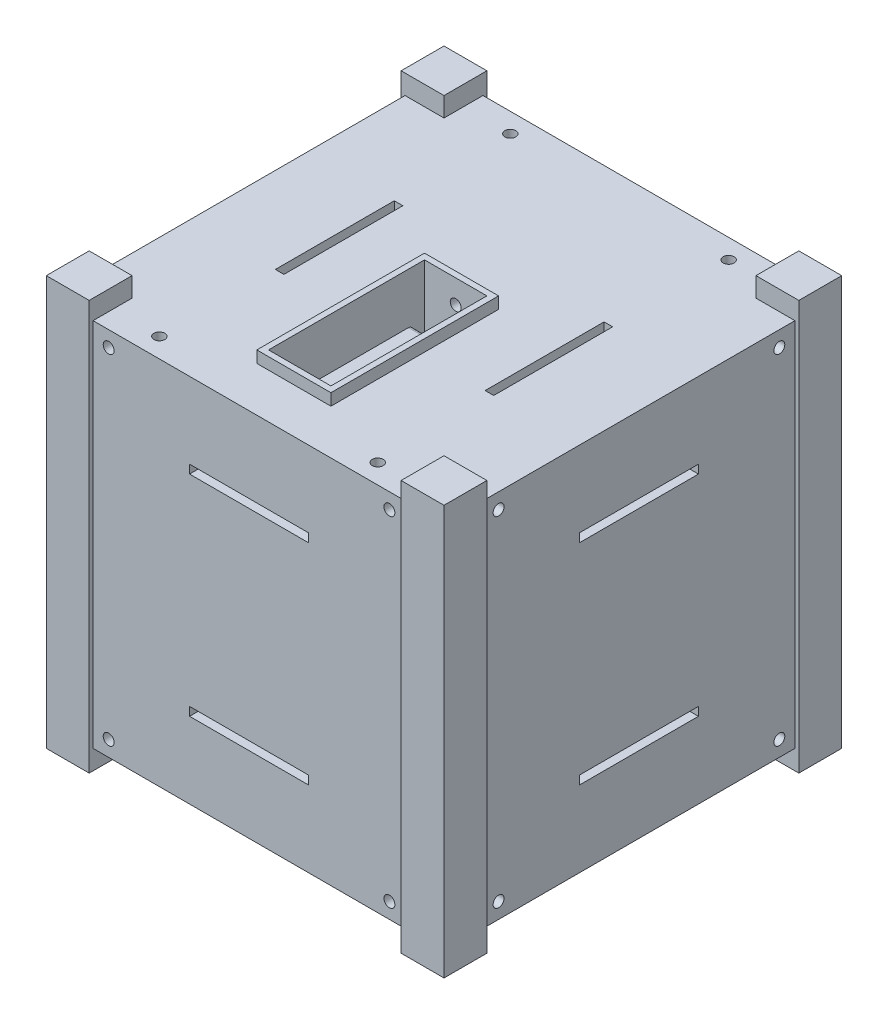
from build123d import *

# Parameters (mm, degrees)
SKETCH1_W           = 100
SKETCH1_H           = 100
BOSS_EXTRUDE1_DEPTH = 95
SKETCH2_W           = 10
SKETCH2_H           = 10
BOSS_EXTRUDE2_DEPTH = 105
SKETCH3_R           = 1.4
CUT_EXTRUDE1_DEPTH  = 10
SKETCH4_W           = 11
SKETCH4_H           = 11
BOSS_EXTRUDE3_DEPTH = 105
SKETCH5_R           = 1.4
CUT_EXTRUDE2_DEPTH  = 10
SKETCH6_R           = 1.4
CUT_EXTRUDE3_DEPTH  = 10
SKETCH7_W           = 19
SKETCH7_H           = 43
SKETCH7_W_2         = 16
SKETCH7_H_2         = 40
BOSS_EXTRUDE4_DEPTH = 3
SKETCH8_W           = 16
SKETCH8_H           = 40
CUT_EXTRUDE4_DEPTH  = 10
CHAMFER2_SIZE       = 13
SKETCH9_W           = 16
SKETCH9_H           = 3.1
CUT_EXTRUDE5_DEPTH  = 10
FILLET1_R           = 1
SKETCH10_R          = 1.4
CUT_EXTRUDE6_DEPTH  = 10
SKETCH11_R          = 5
BOSS_EXTRUDE5_DEPTH = 3
SKETCH12_W          = 30.5
SKETCH12_H          = 2.2
CUT_EXTRUDE7_DEPTH  = 3
SKETCH13_W          = 30.5
SKETCH13_H          = 2.2
CUT_EXTRUDE8_DEPTH  = 3
SKETCH14_W          = 2.2
SKETCH14_H          = 30.5
CUT_EXTRUDE9_DEPTH  = 3


with BuildPart() as part:
    # Sketch1 → Boss-Extrude1 (new body)
    with BuildSketch(Plane(origin=(0, 0, 0), x_dir=(1, 0, 0), z_dir=(0, 1, 0))):
        Rectangle(SKETCH1_W, SKETCH1_H)
    extrude(amount=BOSS_EXTRUDE1_DEPTH)

    # Sketch2 → Boss-Extrude2 (add)
    with BuildSketch(Plane(origin=(0, 100, 0), x_dir=(1, 0, 0), z_dir=(0, 1, 0))):
        with Locations((-45, 45)):
            Rectangle(SKETCH2_W, SKETCH2_H)
        with Locations((45, 45)):
            Rectangle(SKETCH2_W, SKETCH2_H)
        with Locations((45, -45)):
            Rectangle(SKETCH2_W, SKETCH2_H)
        with Locations((-45, -45)):
            Rectangle(SKETCH2_W, SKETCH2_H)
    extrude(amount=-BOSS_EXTRUDE2_DEPTH)

    # Sketch3 → Cut-Extrude1 (cut)
    with BuildSketch(Plane(origin=(0, 95, 0), x_dir=(1, 0, 0), z_dir=(0, 1, 0))):
        with Locations(Location((-28, -45, 0), (0, 0, 270))):
            Circle(SKETCH3_R)
        with Locations(Location((28, -45, 0), (0, 0, 90))):
            Circle(SKETCH3_R)
        with Locations(Location((28, 45, 0), (0, 0, 270))):
            Circle(SKETCH3_R)
        with Locations(Location((-28, 45, 0), (0, 0, 90))):
            Circle(SKETCH3_R)
    cut_extrude1 = extrude(amount=-CUT_EXTRUDE1_DEPTH, mode=Mode.SUBTRACT)

    # Sketch4 → Boss-Extrude3 (add)
    with BuildSketch(Plane(origin=(0, 100, 0), x_dir=(1, 0, 0), z_dir=(0, 1, 0))):
        with Locations((-45.5, 45.5)):
            Rectangle(SKETCH4_W, SKETCH4_H)
        with Locations((45.5, 45.5)):
            Rectangle(SKETCH4_W, SKETCH4_H)
        with Locations((45.5, -45.5)):
            Rectangle(SKETCH4_W, SKETCH4_H)
        with Locations((-45.5, -45.5)):
            Rectangle(SKETCH4_W, SKETCH4_H)
    extrude(amount=-BOSS_EXTRUDE3_DEPTH)

    # Sketch5 → Cut-Extrude2 (cut)
    with BuildSketch(Plane.XY.offset(50)):
        with Locations((-36, 91)):
            Circle(SKETCH5_R)
        with Locations(Location((36, 91, 0), (0, 0, 180))):
            Circle(SKETCH5_R)
        with Locations((36, 4)):
            Circle(SKETCH5_R)
        with Locations(Location((-36, 4, 0), (0, 0, 180))):
            Circle(SKETCH5_R)
    cut_extrude2 = extrude(amount=-CUT_EXTRUDE2_DEPTH, mode=Mode.SUBTRACT)

    # Mirror1: Cut-Extrude2 across plane
    add(cut_extrude2.mirror(Plane.XY), mode=Mode.SUBTRACT)

    # Sketch6 → Cut-Extrude3 (cut)
    with BuildSketch(Plane.ZY.offset(50)):
        with Locations((-36, 91)):
            Circle(SKETCH6_R)
        with Locations(Location((36, 91, 0), (0, 0, 180))):
            Circle(SKETCH6_R)
        with Locations((36, 4)):
            Circle(SKETCH6_R)
        with Locations(Location((-36, 4, 0), (0, 0, 180))):
            Circle(SKETCH6_R)
    cut_extrude3 = extrude(amount=-CUT_EXTRUDE3_DEPTH, mode=Mode.SUBTRACT)

    # Mirror2: Cut-Extrude3 across plane
    add(cut_extrude3.mirror(Plane(origin=(0, 0, 0), x_dir=(0, 0, 1), z_dir=(1, 0, 0))), mode=Mode.SUBTRACT)

    # Mirror3: Cut-Extrude1 across plane
    add(cut_extrude1.mirror(Plane.ZX.offset(47.5)), mode=Mode.SUBTRACT)

    # Sketch7 → Boss-Extrude4 (add)
    with BuildSketch(Plane(origin=(0, 95, 0), x_dir=(1, 0, 0), z_dir=(0, 1, 0))):
        with Locations((0, -17)):
            Rectangle(SKETCH7_W, SKETCH7_H)
        with Locations((0, -17)):
            Rectangle(SKETCH7_W_2, SKETCH7_H_2, mode=Mode.SUBTRACT)
    extrude(amount=BOSS_EXTRUDE4_DEPTH)

    # Sketch8 → Cut-Extrude4 (cut)
    with BuildSketch(Plane(origin=(0, 95, 0), x_dir=(1, 0, 0), z_dir=(0, 1, 0))):
        with Locations((0, -17)):
            Rectangle(SKETCH8_W, SKETCH8_H)
    extrude(amount=-CUT_EXTRUDE4_DEPTH, mode=Mode.SUBTRACT)

    # Chamfer2
    chamfer2_edges = [part.edges().sort_by_distance(p)[0] for p in [
        (0, 85, 37),
    ]]
    chamfer(chamfer2_edges, length=CHAMFER2_SIZE - 0.0001)  # a hair under: the kernel refuses the full size

    # Sketch9 → Cut-Extrude5 (cut)
    with BuildSketch(Plane(origin=(0, 85, 0), x_dir=(1, 0, 0), z_dir=(0, 1, 0))):
        with Locations((0, 1.45)):
            Rectangle(SKETCH9_W, SKETCH9_H)
    extrude(amount=-CUT_EXTRUDE5_DEPTH, mode=Mode.SUBTRACT)

    # Fillet1
    fillet1_edges = [part.edges().sort_by_distance(p)[0] for p in [
        (0, 85, 0.1),
    ]]
    fillet(fillet1_edges, radius=FILLET1_R)

    # Sketch10 → Cut-Extrude6 (cut)
    with BuildSketch(Plane.XY.offset(-3)):
        with Locations((0, 92)):
            Circle(SKETCH10_R)
    extrude(amount=-CUT_EXTRUDE6_DEPTH, mode=Mode.SUBTRACT)

    # Sketch11 → Boss-Extrude5 (add)
    with BuildSketch(Plane.XZ):
        with Locations(Location((0, -15, 0), (0, 0, 90))):
            Circle(SKETCH11_R)
    extrude(amount=BOSS_EXTRUDE5_DEPTH)

    # Sketch12 → Cut-Extrude7 (cut)
    with BuildSketch(Plane.ZY.offset(50)):
        with Locations((0, 74.4)):
            Rectangle(SKETCH12_W, SKETCH12_H)
        with Locations((0, 20.6)):
            Rectangle(SKETCH12_W, SKETCH12_H)
    cut_extrude7 = extrude(amount=-CUT_EXTRUDE7_DEPTH, mode=Mode.SUBTRACT)

    # Mirror4: Cut-Extrude7 across plane
    add(cut_extrude7.mirror(Plane(origin=(0, 0, 0), x_dir=(0, 0, 1), z_dir=(1, 0, 0))), mode=Mode.SUBTRACT)

    # Sketch13 → Cut-Extrude8 (cut)
    with BuildSketch(Plane.XY.offset(50)):
        with Locations((0, 74.4)):
            Rectangle(SKETCH13_W, SKETCH13_H)
        with Locations((0, 20.6)):
            Rectangle(SKETCH13_W, SKETCH13_H)
    cut_extrude8 = extrude(amount=-CUT_EXTRUDE8_DEPTH, mode=Mode.SUBTRACT)

    # Mirror5: Cut-Extrude8 across plane
    add(cut_extrude8.mirror(Plane.XY), mode=Mode.SUBTRACT)

    # Sketch14 → Cut-Extrude9 (cut)
    with BuildSketch(Plane(origin=(0, 95, 0), x_dir=(1, 0, 0), z_dir=(0, 1, 0))):
        with Locations((26.9, 0)):
            Rectangle(SKETCH14_W, SKETCH14_H)
        with Locations((-26.9, 0)):
            Rectangle(SKETCH14_W, SKETCH14_H)
    cut_extrude9 = extrude(amount=-CUT_EXTRUDE9_DEPTH, mode=Mode.SUBTRACT)

    # Mirror6: Cut-Extrude9 across plane
    add(cut_extrude9.mirror(Plane.ZX.offset(47.5)), mode=Mode.SUBTRACT)


solid = part.part
